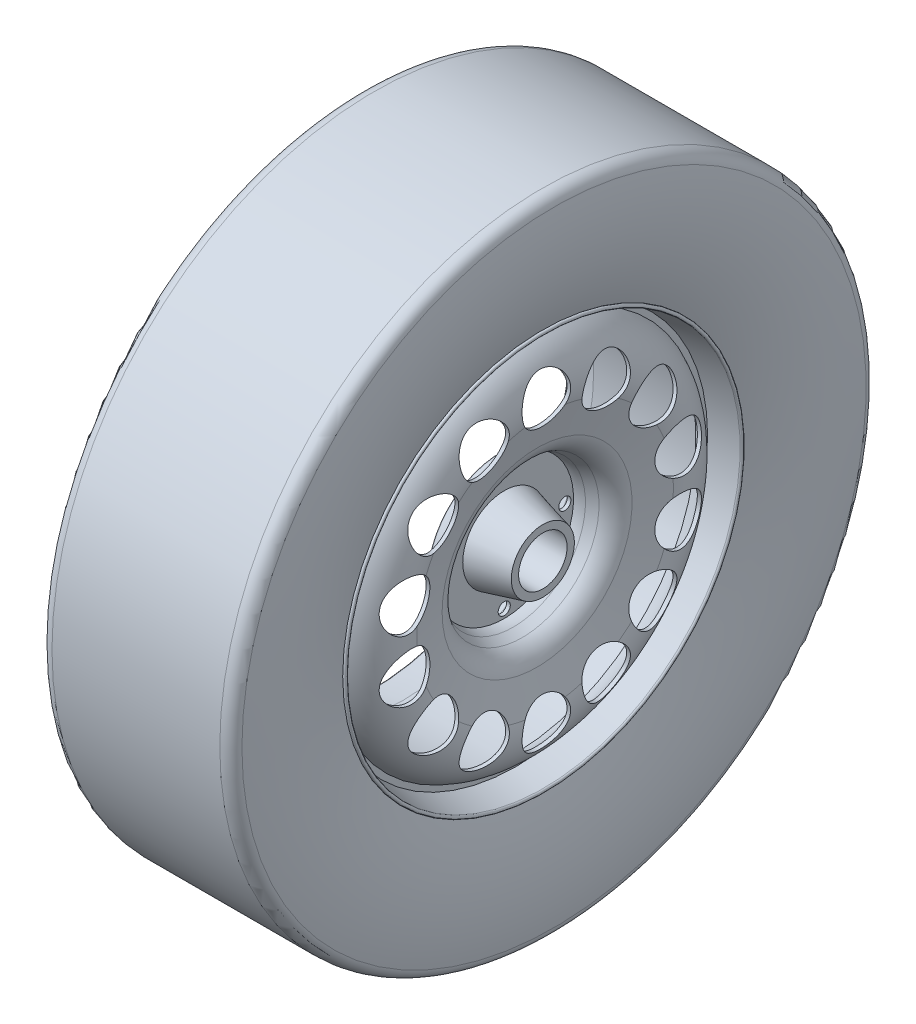
from build123d import *

# Parameters (mm, degrees)
CUT_EXTRUDE1_DEPTH      = 385.680869969
CUT_EXTRUDE1_DEPTH_BACK = 385.680869969
SKETCH1_R               = 5
SKETCH3_R               = 20
CUT_EXTRUDE3_DEPTH      = 385.680869969
CIRPATTERN1_COUNT       = 14


with BuildPart() as part:
    # Sketch2 → Revolve1 (revolve)
    with BuildSketch(Plane.XY):
        with BuildLine():
            Line((35, 23), (35, 20))
            Line((35, 20), (69.85, 20))
            Line((69.85, 20), (69.85, 26))
            Line((69.85, 26), (38, 34.225251076))
            Line((38, 34.225251076), (38, 57.161563053))
            ThreePointArc((38, 57.161563053), (41.880281519, 57.96778869), (45.564553147, 59.428174607))
            Line((45.564553147, 59.428174607), (53.021290705, 63.156543386))
            ThreePointArc((53.021290705, 63.156543386), (60.737667462, 69.41342643), (65.09550934, 78.340927191))
            Line((65.09550934, 78.340927191), (71.709032394, 105.789808378))
            ThreePointArc((71.709032394, 105.789808378), (68.539099042, 133.699664131), (48.152880946, 153.023500122))
            Line((48.152880946, 153.023500122), (48.152880946, 157.612))
            Line((48.152880946, 157.612), (70.449649673, 162.16054082))
            ThreePointArc((70.449649673, 162.16054082), (71.619554426, 163.930095246), (69.85, 165.1))
            Line((69.85, 165.1), (44.85, 160))
            Line((44.85, 160), (-44.85, 160))
            Line((-44.85, 160), (-69.85, 165.1))
            ThreePointArc((-69.85, 165.1), (-71.619554426, 163.930095246), (-70.449649673, 162.16054082))
            Line((-70.449649673, 162.16054082), (-45.152880946, 157))
            Line((-45.152880946, 157), (45.152880946, 157))
            Line((45.152880946, 157), (45.152880946, 151))
            ThreePointArc((45.152880946, 151), (65.408560229, 133.226871346), (68.792493525, 106.492518151))
            Line((68.792493525, 106.492518151), (62.178970471, 79.043636964))
            ThreePointArc((62.178970471, 79.043636964), (58.38954275, 71.280592824), (51.679649919, 65.839824959))
            Line((51.679649919, 65.839824959), (44.22291236, 62.11145618))
            ThreePointArc((44.22291236, 62.11145618), (39.873698861, 60.535020211), (35.27864045, 60))
            Line((35.27864045, 60), (35, 60))
            Line((35, 60), (35, 31.901575256))
            Line((35, 31.901575256), (66.85, 23.67632418))
            Line((66.85, 23.67632418), (66.85, 23))
            Line((66.85, 23), (35, 23))
        make_face()
    revolve(axis=Axis((0, 0, 0), (1, 0, 0)))

    # Sketch1 → Cut-Extrude1 (cut, two sides: drawn at the far end of the back side and taken through both)
    with BuildSketch(Plane(origin=(0, 0, 0), x_dir=(0, 0, -1), z_dir=(1, 0, 0)).offset(-CUT_EXTRUDE1_DEPTH_BACK)):
        with Locations((50, 0)):
            Circle(SKETCH1_R)
        with Locations((0, 50)):
            Circle(SKETCH1_R)
        with Locations((0, -50)):
            Circle(SKETCH1_R)
        with Locations((-50, 0)):
            Circle(SKETCH1_R)
    extrude(amount=CUT_EXTRUDE1_DEPTH + CUT_EXTRUDE1_DEPTH_BACK, mode=Mode.SUBTRACT)

    # Sketch3 → Cut-Extrude3 (cut, symmetric)
    with BuildSketch(Plane(origin=(0, 0, 0), x_dir=(0, 0, -1), z_dir=(1, 0, 0))):
        with Locations((0, 115.7)):
            Circle(SKETCH3_R)
    cut_extrude3 = extrude(amount=CUT_EXTRUDE3_DEPTH, both=True, mode=Mode.SUBTRACT)

    # CirPattern1: Cut-Extrude3 ×14 about axis
    cirpattern1_axis = Axis((69.85, 0, 0), (-1, 0, 0))
    for i in range(1, CIRPATTERN1_COUNT):
        add(cut_extrude3.rotate(cirpattern1_axis, i * 360 / CIRPATTERN1_COUNT), mode=Mode.SUBTRACT)


with BuildPart() as body_2:
    # Sketch2<4> → Revolve2 (revolve)
    with BuildSketch(Plane.XY):
        with BuildLine():
            Line((44.85, 160), (69.85, 165.1))
            ThreePointArc((69.85, 165.1), (80.5154728, 210.673240961), (79.070749579, 257.45556002))
            ThreePointArc((79.070749579, 257.45556002), (75.679077776, 263.467598053), (69.200482256, 265.85))
            Line((69.200482256, 265.85), (-69.200482256, 265.85))
            ThreePointArc((-69.200482256, 265.85), (-75.679077776, 263.467598053), (-79.070749579, 257.45556002))
            ThreePointArc((-79.070749579, 257.45556002), (-80.5154728, 210.673240961), (-69.85, 165.1))
            Line((-69.85, 165.1), (-44.85, 160))
            Line((-44.85, 160), (44.85, 160))
        make_face()
    revolve(axis=Axis((0, 0, 0), (1, 0, 0)))


solid = Compound([part.part, body_2.part])
